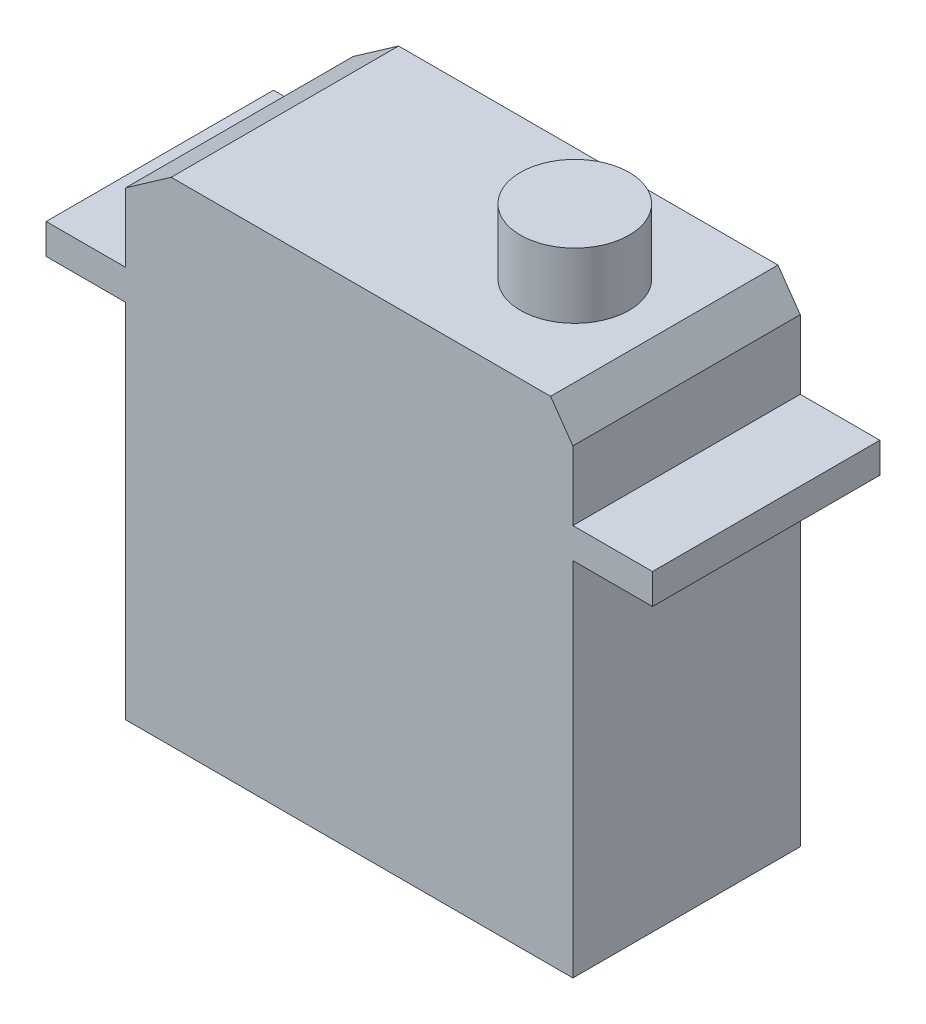
from build123d import *

# Parameters (mm, degrees)
BOSS_EXTRUDE1_DEPTH = 7.5
SKETCH2_R           = 3.587141307
BOSS_EXTRUDE2_DEPTH = 4.3


with BuildPart() as part:
    # Sketch1 → Boss-Extrude1 (new, symmetric)
    with BuildSketch(Plane.XY):
        Polygon((-14.75, 11.925), (-20, 11.925), (-20, 13.925), (-14.75, 13.925), (-14.75, 18.474377385), (-11.75, 20.575), (13.27912821, 20.575), (14.75, 18.474377385), (14.75, 13.925), (20, 13.925), (20, 11.925), (14.75, 11.925), (14.75, -11.925), (-14.75, -11.925), align=None)
    extrude(amount=BOSS_EXTRUDE1_DEPTH, both=True)

    # Sketch2 → Boss-Extrude2 (add)
    with BuildSketch(Plane(origin=(0, 20.575, 0), x_dir=(1, 0, 0), z_dir=(0, 1, 0))):
        with Locations((7.375, 0)):
            Circle(SKETCH2_R)
    extrude(amount=BOSS_EXTRUDE2_DEPTH)


solid = part.part
